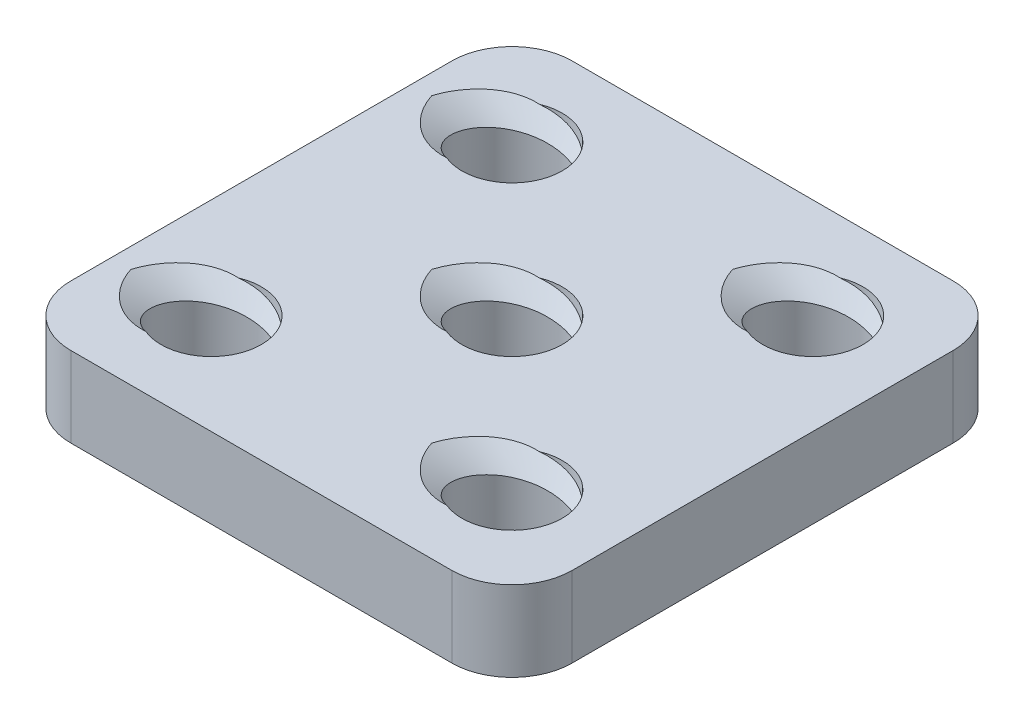
from build123d import *

# Parameters (mm, degrees)
BOSS_EXTRUDE1_DEPTH = 4
SKETCH2_R           = 2.5
CUT_EXTRUDE1_DEPTH  = 4
CUT_SWEEP2_PITCH    = 4
CUT_SWEEP3_PITCH    = 4
CUT_SWEEP5_PITCH    = 4
CUT_SWEEP6_PITCH    = 4
CUT_SWEEP7_PITCH    = 4


with BuildPart() as part:
    # Sketch1 → Boss-Extrude1 (new body)
    with BuildSketch(Plane(origin=(0, 0, 0), x_dir=(1, 0, 0), z_dir=(0, 1, 0))):
        with BuildLine():
            Line((3, 0), (22, 0))
            ThreePointArc((22, 0), (24.121320344, 0.878679656), (25, 3))
            Line((25, 3), (25, 22))
            ThreePointArc((25, 22), (24.121320344, 24.121320344), (22, 25))
            Line((22, 25), (3, 25))
            ThreePointArc((3, 25), (0.878679656, 24.121320344), (0, 22))
            Line((0, 22), (0, 3))
            ThreePointArc((0, 3), (0.878679656, 0.878679656), (3, 0))
        make_face()
    extrude(amount=BOSS_EXTRUDE1_DEPTH)

    # Sketch2 → Cut-Extrude1 (cut)
    with BuildSketch(Plane(origin=(0, 4, 0), x_dir=(1, 0, 0), z_dir=(0, 1, 0))):
        with Locations(Location((5, 20, 0), (0, 0, 270))):
            Circle(SKETCH2_R)
        with Locations(Location((20, 20, 0), (0, 0, 270))):
            Circle(SKETCH2_R)
        with Locations(Location((5, 5, 0), (0, 0, 270))):
            Circle(SKETCH2_R)
        with Locations(Location((20, 5, 0), (0, 0, 270))):
            Circle(SKETCH2_R)
        with Locations(Location((12.5, 12.5, 0), (0, 0, 270))):
            Circle(SKETCH2_R)
    extrude(amount=-CUT_EXTRUDE1_DEPTH, mode=Mode.SUBTRACT)

    # Cut-Sweep2: arcs per turn and ends read off the stored shape
    # Cut-Sweep2: the profile of Sketch6 screwed along a right-hand helix through 2.5 turns, 12 arcs to a turn; built about Z, then put on its axis
    cut_sweep2_z = Axis((0, 0, 0), (0, 0, 1))
    cut_sweep2_corners = [(2.5, 0, -4), (2.5, 0, -4.75), (4, 0, -4), (2.5, 0, -3.25)]
    with BuildLine(mode=Mode.PRIVATE) as cut_sweep2_profile:
        Line(cut_sweep2_corners[0], cut_sweep2_corners[1])
        Line(cut_sweep2_corners[1], cut_sweep2_corners[2])
        Line(cut_sweep2_corners[2], cut_sweep2_corners[3])
        Line(cut_sweep2_corners[3], cut_sweep2_corners[0])
    cut_sweep2_cap = Face(cut_sweep2_profile.wire())
    cut_sweep2_turn_angles = [0, 15, 30, 45, 60, 75, 90, 105, 120, 135, 150, 165, 180, 195, 210, 225, 240, 255, 270, 285, 300, 315, 330, 345, 360]
    cut_sweep2_turn_weights = [1, 0.9659258262890683, 1, 0.9659258262890683, 1, 0.9659258262890683, 1, 0.9659258262890683, 1, 0.9659258262890683, 1, 0.9659258262890683, 1, 0.9659258262890683, 1, 0.9659258262890683, 1, 0.9659258262890683, 1, 0.9659258262890683, 1, 0.9659258262890683, 1, 0.9659258262890683, 1]
    cut_sweep2_turn_rails = [Edge.make_bspline([Vector(p[0], p[1], 0).rotate(cut_sweep2_z, cut_sweep2_turn_angles[k]) / cut_sweep2_turn_weights[k] + Vector(0, 0, p[2] + CUT_SWEEP2_PITCH * cut_sweep2_turn_angles[k] / 360) for k in range(25)], [0, 0, 0, 1, 1, 2, 2, 3, 3, 4, 4, 5, 5, 6, 6, 7, 7, 8, 8, 9, 9, 10, 10, 11, 11, 12, 12, 12], 2, cut_sweep2_turn_weights) for p in cut_sweep2_corners]
    cut_sweep2_turn_sides = [Face.make_surface_from_curves(cut_sweep2_turn_rails[p[0]], cut_sweep2_turn_rails[p[1]]) for p in [(0, 1), (1, 2), (2, 3), (3, 0)]]
    cut_sweep2_last_angles = [720, 735, 750, 765, 780, 795, 810, 825, 840, 855, 870, 885, 900]
    cut_sweep2_last_weights = [1, 0.9659258262890683, 1, 0.9659258262890683, 1, 0.9659258262890683, 1, 0.9659258262890683, 1, 0.9659258262890683, 1, 0.9659258262890683, 1]
    cut_sweep2_last_rails = [Edge.make_bspline([Vector(p[0], p[1], 0).rotate(cut_sweep2_z, cut_sweep2_last_angles[k]) / cut_sweep2_last_weights[k] + Vector(0, 0, p[2] + CUT_SWEEP2_PITCH * cut_sweep2_last_angles[k] / 360) for k in range(13)], [0, 0, 0, 1, 1, 2, 2, 3, 3, 4, 4, 5, 5, 6, 6, 6], 2, cut_sweep2_last_weights) for p in cut_sweep2_corners]
    cut_sweep2_last_sides = [Face.make_surface_from_curves(cut_sweep2_last_rails[p[0]], cut_sweep2_last_rails[p[1]]) for p in [(0, 1), (1, 2), (2, 3), (3, 0)]]
    cut_sweep2 = Plane(origin=(5, 4, -20), x_dir=(-1, 0, 0), z_dir=(0, -1, 0)) * Solid(Shell([*[p.moved(Location((0, 0, CUT_SWEEP2_PITCH * i))) for i in range(2) for p in cut_sweep2_turn_sides], *cut_sweep2_last_sides, cut_sweep2_cap, cut_sweep2_cap.rotate(cut_sweep2_z, 900).moved(Location((0, 0, CUT_SWEEP2_PITCH * 900 / 360)))]))
    add(cut_sweep2, mode=Mode.SUBTRACT)

    # Cut-Sweep3: arcs per turn and ends read off the stored shape
    # Cut-Sweep3: the profile of Sketch8 screwed along a right-hand helix through 2.5 turns, 12 arcs to a turn; built about Z, then put on its axis
    cut_sweep3_z = Axis((0, 0, 0), (0, 0, 1))
    cut_sweep3_corners = [(2.5, 0, -4), (2.5, 0, -4.75), (4, 0, -4), (2.5, 0, -3.25)]
    with BuildLine(mode=Mode.PRIVATE) as cut_sweep3_profile:
        Line(cut_sweep3_corners[0], cut_sweep3_corners[1])
        Line(cut_sweep3_corners[1], cut_sweep3_corners[2])
        Line(cut_sweep3_corners[2], cut_sweep3_corners[3])
        Line(cut_sweep3_corners[3], cut_sweep3_corners[0])
    cut_sweep3_cap = Face(cut_sweep3_profile.wire())
    cut_sweep3_turn_angles = [0, 15, 30, 45, 60, 75, 90, 105, 120, 135, 150, 165, 180, 195, 210, 225, 240, 255, 270, 285, 300, 315, 330, 345, 360]
    cut_sweep3_turn_weights = [1, 0.9659258262890683, 1, 0.9659258262890683, 1, 0.9659258262890683, 1, 0.9659258262890683, 1, 0.9659258262890683, 1, 0.9659258262890683, 1, 0.9659258262890683, 1, 0.9659258262890683, 1, 0.9659258262890683, 1, 0.9659258262890683, 1, 0.9659258262890683, 1, 0.9659258262890683, 1]
    cut_sweep3_turn_rails = [Edge.make_bspline([Vector(p[0], p[1], 0).rotate(cut_sweep3_z, cut_sweep3_turn_angles[k]) / cut_sweep3_turn_weights[k] + Vector(0, 0, p[2] + CUT_SWEEP3_PITCH * cut_sweep3_turn_angles[k] / 360) for k in range(25)], [0, 0, 0, 1, 1, 2, 2, 3, 3, 4, 4, 5, 5, 6, 6, 7, 7, 8, 8, 9, 9, 10, 10, 11, 11, 12, 12, 12], 2, cut_sweep3_turn_weights) for p in cut_sweep3_corners]
    cut_sweep3_turn_sides = [Face.make_surface_from_curves(cut_sweep3_turn_rails[p[0]], cut_sweep3_turn_rails[p[1]]) for p in [(0, 1), (1, 2), (2, 3), (3, 0)]]
    cut_sweep3_last_angles = [720, 735, 750, 765, 780, 795, 810, 825, 840, 855, 870, 885, 900]
    cut_sweep3_last_weights = [1, 0.9659258262890683, 1, 0.9659258262890683, 1, 0.9659258262890683, 1, 0.9659258262890683, 1, 0.9659258262890683, 1, 0.9659258262890683, 1]
    cut_sweep3_last_rails = [Edge.make_bspline([Vector(p[0], p[1], 0).rotate(cut_sweep3_z, cut_sweep3_last_angles[k]) / cut_sweep3_last_weights[k] + Vector(0, 0, p[2] + CUT_SWEEP3_PITCH * cut_sweep3_last_angles[k] / 360) for k in range(13)], [0, 0, 0, 1, 1, 2, 2, 3, 3, 4, 4, 5, 5, 6, 6, 6], 2, cut_sweep3_last_weights) for p in cut_sweep3_corners]
    cut_sweep3_last_sides = [Face.make_surface_from_curves(cut_sweep3_last_rails[p[0]], cut_sweep3_last_rails[p[1]]) for p in [(0, 1), (1, 2), (2, 3), (3, 0)]]
    cut_sweep3 = Plane(origin=(20, 4, -20), x_dir=(-1, 0, 0), z_dir=(0, -1, 0)) * Solid(Shell([*[p.moved(Location((0, 0, CUT_SWEEP3_PITCH * i))) for i in range(2) for p in cut_sweep3_turn_sides], *cut_sweep3_last_sides, cut_sweep3_cap, cut_sweep3_cap.rotate(cut_sweep3_z, 900).moved(Location((0, 0, CUT_SWEEP3_PITCH * 900 / 360)))]))
    add(cut_sweep3, mode=Mode.SUBTRACT)

    # Cut-Sweep5: arcs per turn and ends read off the stored shape
    # Cut-Sweep5: the profile of Sketch11 screwed along a right-hand helix through 2.5 turns, 12 arcs to a turn; built about Z, then put on its axis
    cut_sweep5_z = Axis((0, 0, 0), (0, 0, 1))
    cut_sweep5_corners = [(2.5, 0, -4), (2.5, 0, -3.25), (4, 0, -4), (2.5, 0, -4.75)]
    with BuildLine(mode=Mode.PRIVATE) as cut_sweep5_profile:
        Line(cut_sweep5_corners[0], cut_sweep5_corners[1])
        Line(cut_sweep5_corners[1], cut_sweep5_corners[2])
        Line(cut_sweep5_corners[2], cut_sweep5_corners[3])
        Line(cut_sweep5_corners[3], cut_sweep5_corners[0])
    cut_sweep5_cap = Face(cut_sweep5_profile.wire())
    cut_sweep5_turn_angles = [0, 15, 30, 45, 60, 75, 90, 105, 120, 135, 150, 165, 180, 195, 210, 225, 240, 255, 270, 285, 300, 315, 330, 345, 360]
    cut_sweep5_turn_weights = [1, 0.9659258262890683, 1, 0.9659258262890683, 1, 0.9659258262890683, 1, 0.9659258262890683, 1, 0.9659258262890683, 1, 0.9659258262890683, 1, 0.9659258262890683, 1, 0.9659258262890683, 1, 0.9659258262890683, 1, 0.9659258262890683, 1, 0.9659258262890683, 1, 0.9659258262890683, 1]
    cut_sweep5_turn_rails = [Edge.make_bspline([Vector(p[0], p[1], 0).rotate(cut_sweep5_z, cut_sweep5_turn_angles[k]) / cut_sweep5_turn_weights[k] + Vector(0, 0, p[2] + CUT_SWEEP5_PITCH * cut_sweep5_turn_angles[k] / 360) for k in range(25)], [0, 0, 0, 1, 1, 2, 2, 3, 3, 4, 4, 5, 5, 6, 6, 7, 7, 8, 8, 9, 9, 10, 10, 11, 11, 12, 12, 12], 2, cut_sweep5_turn_weights) for p in cut_sweep5_corners]
    cut_sweep5_turn_sides = [Face.make_surface_from_curves(cut_sweep5_turn_rails[p[0]], cut_sweep5_turn_rails[p[1]]) for p in [(0, 1), (1, 2), (2, 3), (3, 0)]]
    cut_sweep5_last_angles = [720, 735, 750, 765, 780, 795, 810, 825, 840, 855, 870, 885, 900]
    cut_sweep5_last_weights = [1, 0.9659258262890683, 1, 0.9659258262890683, 1, 0.9659258262890683, 1, 0.9659258262890683, 1, 0.9659258262890683, 1, 0.9659258262890683, 1]
    cut_sweep5_last_rails = [Edge.make_bspline([Vector(p[0], p[1], 0).rotate(cut_sweep5_z, cut_sweep5_last_angles[k]) / cut_sweep5_last_weights[k] + Vector(0, 0, p[2] + CUT_SWEEP5_PITCH * cut_sweep5_last_angles[k] / 360) for k in range(13)], [0, 0, 0, 1, 1, 2, 2, 3, 3, 4, 4, 5, 5, 6, 6, 6], 2, cut_sweep5_last_weights) for p in cut_sweep5_corners]
    cut_sweep5_last_sides = [Face.make_surface_from_curves(cut_sweep5_last_rails[p[0]], cut_sweep5_last_rails[p[1]]) for p in [(0, 1), (1, 2), (2, 3), (3, 0)]]
    cut_sweep5 = Plane(origin=(5, 4, -5), x_dir=(-1, 0, 0), z_dir=(0, -1, 0)) * Solid(Shell([*[p.moved(Location((0, 0, CUT_SWEEP5_PITCH * i))) for i in range(2) for p in cut_sweep5_turn_sides], *cut_sweep5_last_sides, cut_sweep5_cap, cut_sweep5_cap.rotate(cut_sweep5_z, 900).moved(Location((0, 0, CUT_SWEEP5_PITCH * 900 / 360)))]))
    add(cut_sweep5, mode=Mode.SUBTRACT)

    # Cut-Sweep6: arcs per turn and ends read off the stored shape
    # Cut-Sweep6: the profile of Sketch12 screwed along a right-hand helix through 2.5 turns, 12 arcs to a turn; built about Z, then put on its axis
    cut_sweep6_z = Axis((0, 0, 0), (0, 0, 1))
    cut_sweep6_corners = [(2.5, 0, -4), (2.5, 0, -4.75), (4, 0, -4), (2.5, 0, -3.25)]
    with BuildLine(mode=Mode.PRIVATE) as cut_sweep6_profile:
        Line(cut_sweep6_corners[0], cut_sweep6_corners[1])
        Line(cut_sweep6_corners[1], cut_sweep6_corners[2])
        Line(cut_sweep6_corners[2], cut_sweep6_corners[3])
        Line(cut_sweep6_corners[3], cut_sweep6_corners[0])
    cut_sweep6_cap = Face(cut_sweep6_profile.wire())
    cut_sweep6_turn_angles = [0, 15, 30, 45, 60, 75, 90, 105, 120, 135, 150, 165, 180, 195, 210, 225, 240, 255, 270, 285, 300, 315, 330, 345, 360]
    cut_sweep6_turn_weights = [1, 0.9659258262890683, 1, 0.9659258262890683, 1, 0.9659258262890683, 1, 0.9659258262890683, 1, 0.9659258262890683, 1, 0.9659258262890683, 1, 0.9659258262890683, 1, 0.9659258262890683, 1, 0.9659258262890683, 1, 0.9659258262890683, 1, 0.9659258262890683, 1, 0.9659258262890683, 1]
    cut_sweep6_turn_rails = [Edge.make_bspline([Vector(p[0], p[1], 0).rotate(cut_sweep6_z, cut_sweep6_turn_angles[k]) / cut_sweep6_turn_weights[k] + Vector(0, 0, p[2] + CUT_SWEEP6_PITCH * cut_sweep6_turn_angles[k] / 360) for k in range(25)], [0, 0, 0, 1, 1, 2, 2, 3, 3, 4, 4, 5, 5, 6, 6, 7, 7, 8, 8, 9, 9, 10, 10, 11, 11, 12, 12, 12], 2, cut_sweep6_turn_weights) for p in cut_sweep6_corners]
    cut_sweep6_turn_sides = [Face.make_surface_from_curves(cut_sweep6_turn_rails[p[0]], cut_sweep6_turn_rails[p[1]]) for p in [(0, 1), (1, 2), (2, 3), (3, 0)]]
    cut_sweep6_last_angles = [720, 735, 750, 765, 780, 795, 810, 825, 840, 855, 870, 885, 900]
    cut_sweep6_last_weights = [1, 0.9659258262890683, 1, 0.9659258262890683, 1, 0.9659258262890683, 1, 0.9659258262890683, 1, 0.9659258262890683, 1, 0.9659258262890683, 1]
    cut_sweep6_last_rails = [Edge.make_bspline([Vector(p[0], p[1], 0).rotate(cut_sweep6_z, cut_sweep6_last_angles[k]) / cut_sweep6_last_weights[k] + Vector(0, 0, p[2] + CUT_SWEEP6_PITCH * cut_sweep6_last_angles[k] / 360) for k in range(13)], [0, 0, 0, 1, 1, 2, 2, 3, 3, 4, 4, 5, 5, 6, 6, 6], 2, cut_sweep6_last_weights) for p in cut_sweep6_corners]
    cut_sweep6_last_sides = [Face.make_surface_from_curves(cut_sweep6_last_rails[p[0]], cut_sweep6_last_rails[p[1]]) for p in [(0, 1), (1, 2), (2, 3), (3, 0)]]
    cut_sweep6 = Plane(origin=(20, 4, -5), x_dir=(-1, 0, 0), z_dir=(0, -1, 0)) * Solid(Shell([*[p.moved(Location((0, 0, CUT_SWEEP6_PITCH * i))) for i in range(2) for p in cut_sweep6_turn_sides], *cut_sweep6_last_sides, cut_sweep6_cap, cut_sweep6_cap.rotate(cut_sweep6_z, 900).moved(Location((0, 0, CUT_SWEEP6_PITCH * 900 / 360)))]))
    add(cut_sweep6, mode=Mode.SUBTRACT)

    # Cut-Sweep7: arcs per turn and ends read off the stored shape
    # Cut-Sweep7: the profile of Sketch14 screwed along a right-hand helix through 2.5 turns, 12 arcs to a turn; built about Z, then put on its axis
    cut_sweep7_z = Axis((0, 0, 0), (0, 0, 1))
    cut_sweep7_corners = [(2.5, 0, -4), (2.5, 0, -4.75), (4, 0, -4), (2.5, 0, -3.25)]
    with BuildLine(mode=Mode.PRIVATE) as cut_sweep7_profile:
        Line(cut_sweep7_corners[0], cut_sweep7_corners[1])
        Line(cut_sweep7_corners[1], cut_sweep7_corners[2])
        Line(cut_sweep7_corners[2], cut_sweep7_corners[3])
        Line(cut_sweep7_corners[3], cut_sweep7_corners[0])
    cut_sweep7_cap = Face(cut_sweep7_profile.wire())
    cut_sweep7_turn_angles = [0, 15, 30, 45, 60, 75, 90, 105, 120, 135, 150, 165, 180, 195, 210, 225, 240, 255, 270, 285, 300, 315, 330, 345, 360]
    cut_sweep7_turn_weights = [1, 0.9659258262890683, 1, 0.9659258262890683, 1, 0.9659258262890683, 1, 0.9659258262890683, 1, 0.9659258262890683, 1, 0.9659258262890683, 1, 0.9659258262890683, 1, 0.9659258262890683, 1, 0.9659258262890683, 1, 0.9659258262890683, 1, 0.9659258262890683, 1, 0.9659258262890683, 1]
    cut_sweep7_turn_rails = [Edge.make_bspline([Vector(p[0], p[1], 0).rotate(cut_sweep7_z, cut_sweep7_turn_angles[k]) / cut_sweep7_turn_weights[k] + Vector(0, 0, p[2] + CUT_SWEEP7_PITCH * cut_sweep7_turn_angles[k] / 360) for k in range(25)], [0, 0, 0, 1, 1, 2, 2, 3, 3, 4, 4, 5, 5, 6, 6, 7, 7, 8, 8, 9, 9, 10, 10, 11, 11, 12, 12, 12], 2, cut_sweep7_turn_weights) for p in cut_sweep7_corners]
    cut_sweep7_turn_sides = [Face.make_surface_from_curves(cut_sweep7_turn_rails[p[0]], cut_sweep7_turn_rails[p[1]]) for p in [(0, 1), (1, 2), (2, 3), (3, 0)]]
    cut_sweep7_last_angles = [720, 735, 750, 765, 780, 795, 810, 825, 840, 855, 870, 885, 900]
    cut_sweep7_last_weights = [1, 0.9659258262890683, 1, 0.9659258262890683, 1, 0.9659258262890683, 1, 0.9659258262890683, 1, 0.9659258262890683, 1, 0.9659258262890683, 1]
    cut_sweep7_last_rails = [Edge.make_bspline([Vector(p[0], p[1], 0).rotate(cut_sweep7_z, cut_sweep7_last_angles[k]) / cut_sweep7_last_weights[k] + Vector(0, 0, p[2] + CUT_SWEEP7_PITCH * cut_sweep7_last_angles[k] / 360) for k in range(13)], [0, 0, 0, 1, 1, 2, 2, 3, 3, 4, 4, 5, 5, 6, 6, 6], 2, cut_sweep7_last_weights) for p in cut_sweep7_corners]
    cut_sweep7_last_sides = [Face.make_surface_from_curves(cut_sweep7_last_rails[p[0]], cut_sweep7_last_rails[p[1]]) for p in [(0, 1), (1, 2), (2, 3), (3, 0)]]
    cut_sweep7 = Plane(origin=(12.5, 4, -12.5), x_dir=(-1, 0, 0), z_dir=(0, -1, 0)) * Solid(Shell([*[p.moved(Location((0, 0, CUT_SWEEP7_PITCH * i))) for i in range(2) for p in cut_sweep7_turn_sides], *cut_sweep7_last_sides, cut_sweep7_cap, cut_sweep7_cap.rotate(cut_sweep7_z, 900).moved(Location((0, 0, CUT_SWEEP7_PITCH * 900 / 360)))]))
    add(cut_sweep7, mode=Mode.SUBTRACT)


solid = part.part
